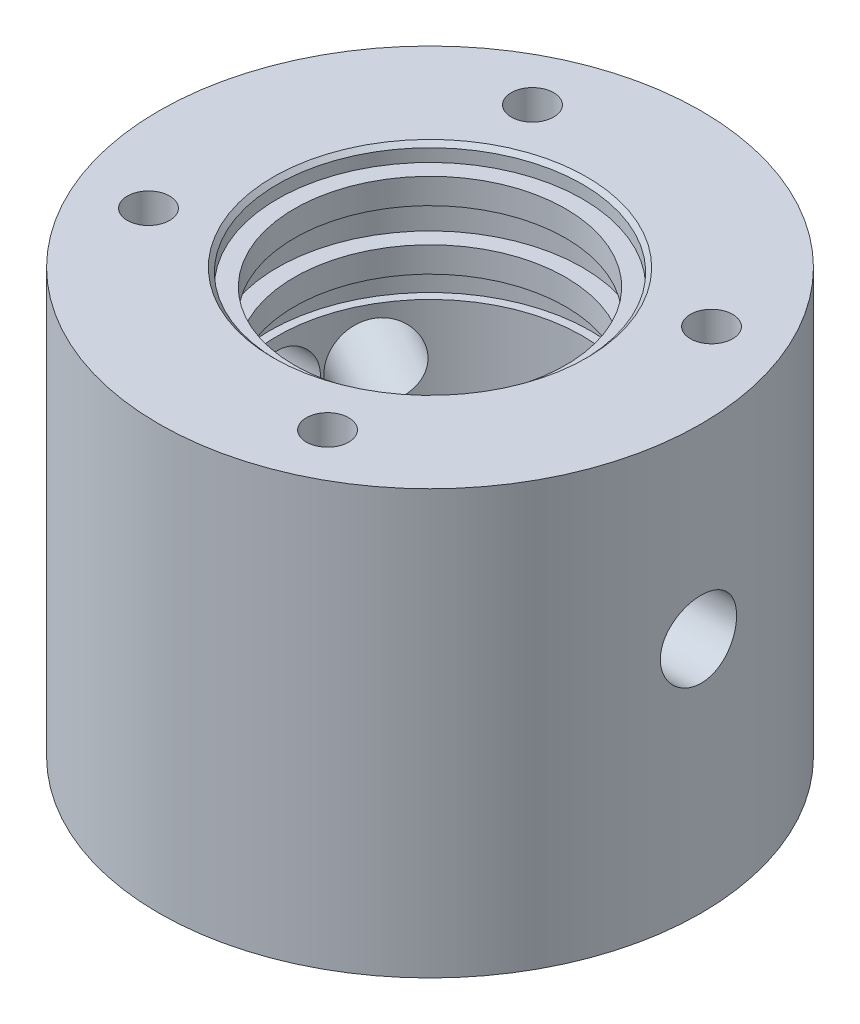
from build123d import *

# Parameters (mm, degrees)
ESBO_O4_W                        = 2.25
ESBO_O4_H                        = 16
F_4_5_4_5_DIAMETER_HOLE2_D       = 4.5
F_4_5_4_5_DIAMETER_HOLE2_DEPTH   = 18
F_4_5_4_5_DIAMETER_HOLE2_TIP     = 1.351936393
ESBO_O12_R                       = 16
ESBO_O12_R_2                     = 9
RESSALTO_EXTRUS_O1_DEPTH         = 1
CHANFRO1_SIZE                    = 0.5
CHANFRO2_SIZE                    = 0.25
FURO_DE_DI_METRO_4_5_4_5_2_D     = 4.5
FURO_DE_DI_METRO_4_5_4_5_2_DEPTH = 8
FURO_DE_DI_METRO_4_5_4_5_2_TIP   = 1.351936393


# Read off the part's stored shape, not the designer's step: PadrãoCircular5
with BuildPart() as part:
    # Esboço1 → Revolução1 (revolve)
    with BuildSketch(Plane.XY, mode=Mode.PRIVATE) as revolu_o1_sk:
        Polygon((3, -14), (16, -14), (16, 10), (8, 10), (8, 8.5), (9, 8.5), (9, 6.5), (8, 6.5), (8, 5), (9.5, 5), (9.5, 3), (9, 3), (9, -3), (9.5, -3), (9.5, -5), (8, -5), (8, -6.5), (9, -6.5), (9, -8.5), (8, -8.5), (8, -10), (3, -10), align=None)
    revolve(revolu_o1_sk.sketch.rotate(Axis((0, -14, 0), (0, 1, 0)), 90), axis=Axis((0, -14, 0), (0, 1, 0)))

    # Esboço4 → Furo de diâmetro Ø4.5 (4.5)1 (revolve, cut)
    with BuildSketch(Plane(origin=(16, 0, 0), x_dir=(0, 0, -1), z_dir=(0, 1, 0))):
        with Locations((1.125, 8)):
            Rectangle(ESBO_O4_W, ESBO_O4_H)
    revolve(axis=Axis((22.35, 0, 0), (-1, 0, 0)), mode=Mode.SUBTRACT)

    # Ø4.5 (4.5) Diameter Hole2
    with Locations(Plane(origin=(-13.856406461, 0, -8), x_dir=(0, -1, 0), z_dir=(-0.8660254037844364, 0, -0.5000000000000041))):
        with Locations((0, 0)):
            Hole(F_4_5_4_5_DIAMETER_HOLE2_D / 2, depth=F_4_5_4_5_DIAMETER_HOLE2_DEPTH)
            with Locations((0, 0, -(F_4_5_4_5_DIAMETER_HOLE2_DEPTH + F_4_5_4_5_DIAMETER_HOLE2_TIP / 2))):  # 118° drill point
                Cone(0, F_4_5_4_5_DIAMETER_HOLE2_D / 2, F_4_5_4_5_DIAMETER_HOLE2_TIP, mode=Mode.SUBTRACT)

    # Esboço12 → Ressalto-extrusão1 (add)
    with BuildSketch(Plane(origin=(0, 10, 0), x_dir=(1, 0, 0), z_dir=(0, 1, 0))):
        with Locations(Location((0, 0, 0), (0, 0, 90))):
            Circle(ESBO_O12_R)
        with Locations(Location((0, 0, 0), (0, 0, 90))):
            Circle(ESBO_O12_R_2, mode=Mode.SUBTRACT)
    extrude(amount=RESSALTO_EXTRUS_O1_DEPTH)

    # Esboço13 → Furo roscado de M3x0.51 (revolve, cut)
    with BuildSketch(Plane(origin=(11.328847338, 11, -5.282728272), x_dir=(0, 0, 1), z_dir=(1, 0, 0))):
        Polygon((0, 0), (0, 10.751075774), (1.25, 10), (1.25, 0), align=None)
    revolve(axis=Axis((11.328847338, 17.35, -5.282728272), (0, -1, 0)), mode=Mode.SUBTRACT)

    # PadrãoCircular5 outline → PadrãoCircular5 (revolve, cut)
    with BuildSketch(Plane(origin=(5.282728272, 0, 11.328847338), x_dir=(1, 0, 0), z_dir=(0, 0, 1))):
        Polygon((0, 11), (0, 0.248924226), (1.25, 1), (1.25, 11), align=None)
    revolve(axis=Axis((5.282728272, 0, 11.328847338), (0, 1, 0)), mode=Mode.SUBTRACT)

    # Padr_oCircular5 2 outline → Padr_oCircular5 2 (revolve, cut)
    with BuildSketch(Plane(origin=(-11.328847338, 0, 5.282728272), x_dir=(1, 0, 0), z_dir=(0, 0, 1))):
        Polygon((0, 11), (0, 0.248924226), (1.25, 1), (1.25, 11), align=None)
    revolve(axis=Axis((-11.328847338, 0, 5.282728272), (0, 1, 0)), mode=Mode.SUBTRACT)

    # Padr_oCircular5 3 outline → Padr_oCircular5 3 (revolve, cut)
    with BuildSketch(Plane(origin=(-5.282728272, 0, -11.328847338), x_dir=(1, 0, 0), z_dir=(0, 0, 1))):
        Polygon((0, 11), (0, 0.248924226), (1.25, 1), (1.25, 11), align=None)
    revolve(axis=Axis((-5.282728272, 0, -11.328847338), (0, 1, 0)), mode=Mode.SUBTRACT)

    # Chanfro1
    chanfro1_edges = [part.edges().sort_by_distance(p)[0] for p in [
        (0, -10, 3),
    ]]
    chamfer(chanfro1_edges, length=CHANFRO1_SIZE)

    # Chanfro2
    chanfro2_edges = [part.edges().sort_by_distance(p)[0] for p in [
        (0, 11, 9),
    ]]
    chamfer(chanfro2_edges, length=CHANFRO2_SIZE)

    # Furo de diâmetro Ø4.5 (4.5)2
    with Locations(Plane(origin=(-16, 0, 0), x_dir=(0, 0, -1), z_dir=(-1, 0, 0))):
        with Locations((0, 0)):
            Hole(FURO_DE_DI_METRO_4_5_4_5_2_D / 2, depth=FURO_DE_DI_METRO_4_5_4_5_2_DEPTH)
            with Locations((0, 0, -(FURO_DE_DI_METRO_4_5_4_5_2_DEPTH + FURO_DE_DI_METRO_4_5_4_5_2_TIP / 2))):  # 118° drill point
                Cone(0, FURO_DE_DI_METRO_4_5_4_5_2_D / 2, FURO_DE_DI_METRO_4_5_4_5_2_TIP, mode=Mode.SUBTRACT)


solid = part.part
